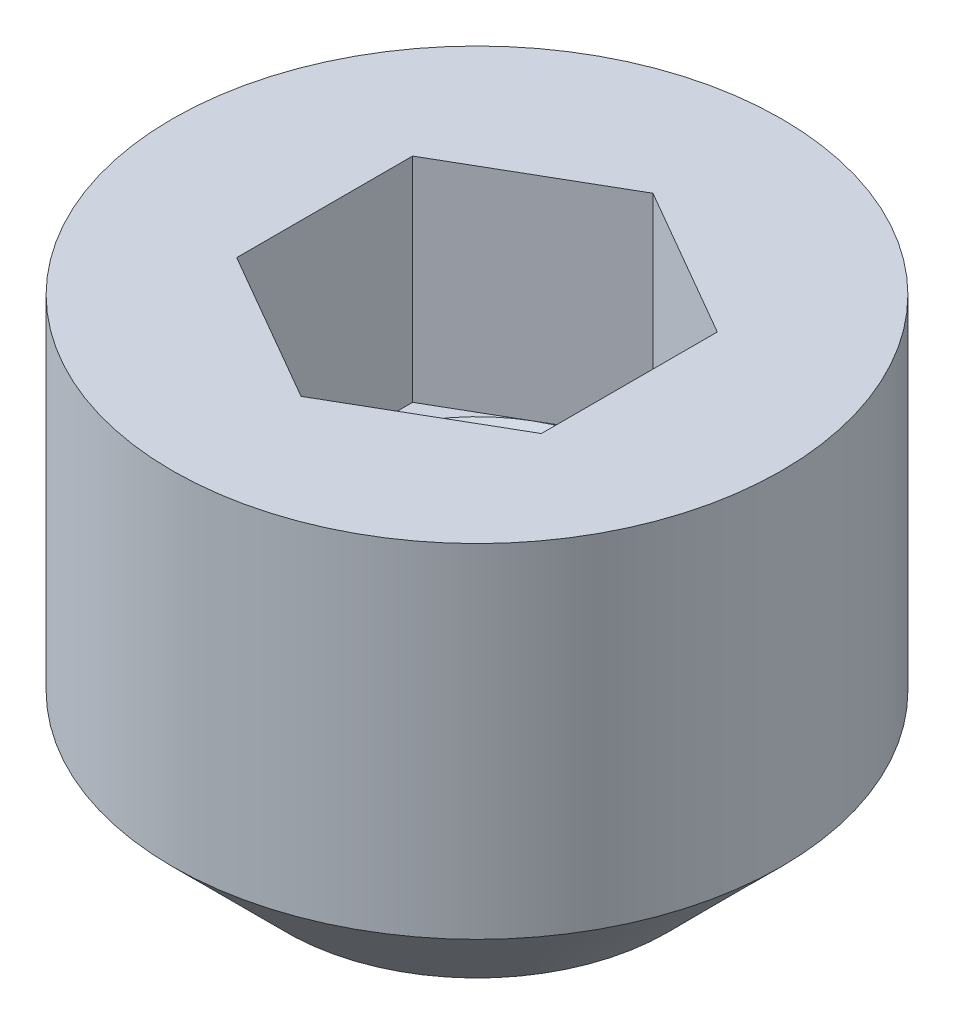
from build123d import *

# Parameters (mm, degrees)
SKETCH1_W          = 2
SKETCH1_H          = 3
CUT_EXTRUDE1_DEPTH = 1.4


with BuildPart() as part:
    # Sketch1 → Revolve1 (revolve)
    with BuildSketch(Plane.XY):
        with Locations((1, 1.5)):
            Rectangle(SKETCH1_W, SKETCH1_H)
    revolve(axis=Axis((0, 3, 0), (0, -1, 0)))

    # Sketch2 → Cut-Revolve1 (revolve, cut)
    with BuildSketch(Plane.XY):
        Polygon((0, 3), (1, 3), (1, 1.6), (0, 1.022649731), align=None)
    revolve(axis=Axis((0, 3, 0), (0, -1, 0)), mode=Mode.SUBTRACT)

    # Sketch3 → Cut-Extrude1 (cut)
    with BuildSketch(Plane(origin=(0, 3, 0), x_dir=(1, 0, 0), z_dir=(0, 1, 0))):
        Polygon((0, 1.154700538), (-1, 0.577350269), (-1, -0.577350269), (0, -1.154700538), (1, -0.577350269), (1, 0.577350269), align=None)
    extrude(amount=-CUT_EXTRUDE1_DEPTH, mode=Mode.SUBTRACT)

    # Sketch4 → Cut-Revolve2 (revolve, cut)
    with BuildSketch(Plane.XY):
        Polygon((2, 0.75), (2, 0), (1.25, 0), align=None)
    revolve(axis=Axis((0, 3, 0), (0, -1, 0)), mode=Mode.SUBTRACT)


solid = part.part
